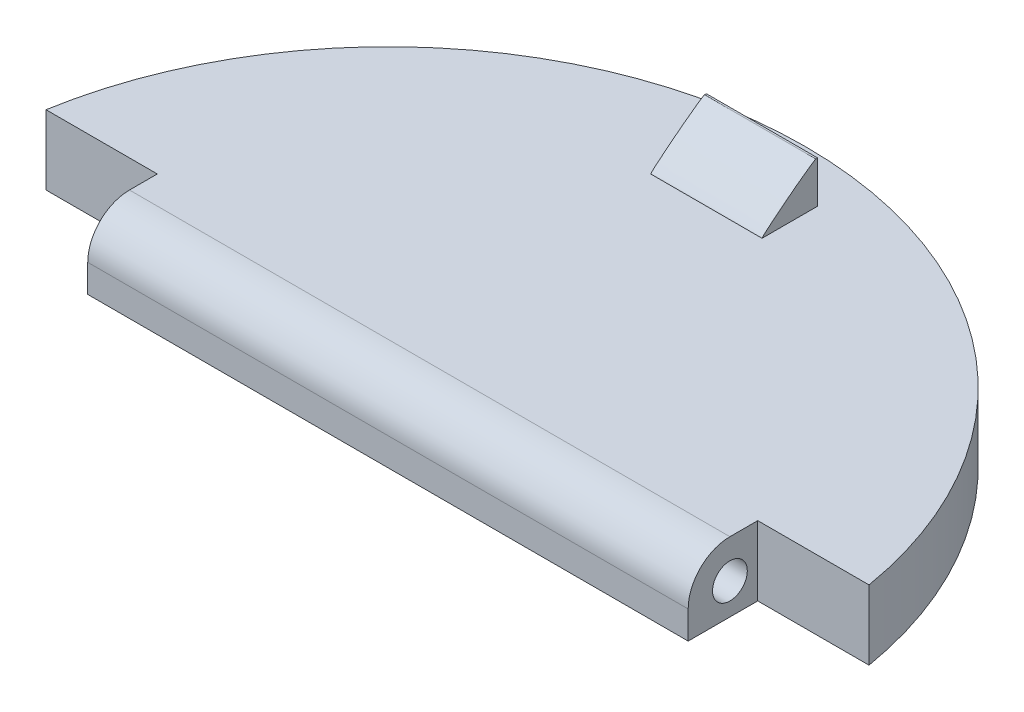
from build123d import *

# Parameters (mm, degrees)
BOSS_EXTRUDE1_DEPTH = 5
SKETCH3_W           = 8
SKETCH3_H           = 4
BOSS_EXTRUDE2_DEPTH = 3
FILLET1_START       = -3.841593316
FILLET1_DEPTH       = 8
CUT_EXTRUDE1_START  = -10
CUT_EXTRUDE1_DEPTH  = 10
FILLET2_R           = 3
SKETCH6_R           = 1.25
CUT_EXTRUDE2_DEPTH  = 5
CUT_EXTRUDE3_START  = -5
SKETCH7_R           = 1.25
CUT_EXTRUDE3_DEPTH  = 5


with BuildPart() as part:
    # Sketch1 → Boss-Extrude1 (new body)
    with BuildSketch(Plane(origin=(0, 0, 0), x_dir=(1, 0, 0), z_dir=(0, 1, 0))):
        with BuildLine():
            Line((-30, 0), (30, 0))
            ThreePointArc((30, 0), (0, 30), (-30, 0))
        make_face()
    extrude(amount=BOSS_EXTRUDE1_DEPTH)

    # Sketch3 → Boss-Extrude2 (add)
    with BuildSketch(Plane(origin=(0, 5, 0), x_dir=(1, 0, 0), z_dir=(0, 1, 0))):
        with Locations((0.158406684, 24.731666579)):
            Rectangle(SKETCH3_W, SKETCH3_H)
    extrude(amount=BOSS_EXTRUDE2_DEPTH)

    # Fillet1: read off the stored shape, not the designer's step
    # Fillet1 outline → Fillet1 (cut)
    with BuildSketch(Plane.YZ.offset(FILLET1_START)):
        with BuildLine():
            Line((8, -22.731666579), (5, -22.731666579))
            add(Edge.make_bspline(
                [(5, -22.731666579), (8, -23.506263249), (8, -26.604649926)],
                knots=[0, 0, 0, 1, 1, 1], degree=2, weights=[1, 0.057495957, 1]))
            Line((8, -26.604649926), (8, -22.731666579))
        make_face()
    extrude(amount=FILLET1_DEPTH, mode=Mode.SUBTRACT)

    # Sketch5 → Cut-Extrude1 (cut)
    with BuildSketch(Plane(origin=(0, 5, 0), x_dir=(1, 0, 0), z_dir=(0, 1, 0)).offset(CUT_EXTRUDE1_START)):
        with BuildLine():
            Line((-21.580398915, 0), (-21.580398915, 5))
            Line((-21.580398915, 5), (-29.580398915, 5))
            ThreePointArc((-29.580398915, 5), (-29.894915684, 2.508787808), (-30, 0))
            Line((-30, 0), (-21.580398915, 0))
        make_face()
        with BuildLine():
            Line((21.580398915, 5), (29.580398915, 5))
            ThreePointArc((29.580398915, 5), (29.894915684, 2.508787808), (30, 0))
            Line((30, 0), (21.580398915, 0))
            Line((21.580398915, 0), (21.580398915, 5))
        make_face()
    extrude(amount=CUT_EXTRUDE1_DEPTH, mode=Mode.SUBTRACT)

    # Fillet2
    fillet2_edges = [part.edges().sort_by_distance(p)[0] for p in [
        (0, 5, 0),
    ]]
    fillet(fillet2_edges, radius=FILLET2_R)

    # Sketch6 → Cut-Extrude2 (cut)
    with BuildSketch(Plane(origin=(21.580398915, 0, 0), x_dir=(0, 0, -1), z_dir=(1, 0, 0))):
        with Locations((3, 2.25)):
            Circle(SKETCH6_R)
    extrude(amount=-CUT_EXTRUDE2_DEPTH, mode=Mode.SUBTRACT)

    # Sketch7 → Cut-Extrude3 (cut)
    with BuildSketch(Plane.ZY.offset(21.580398915).offset(CUT_EXTRUDE3_START)):
        with Locations(Location((-3, 2.25, 0), (0, 0, 180))):
            Circle(SKETCH7_R)
    extrude(amount=CUT_EXTRUDE3_DEPTH, mode=Mode.SUBTRACT)


solid = part.part
